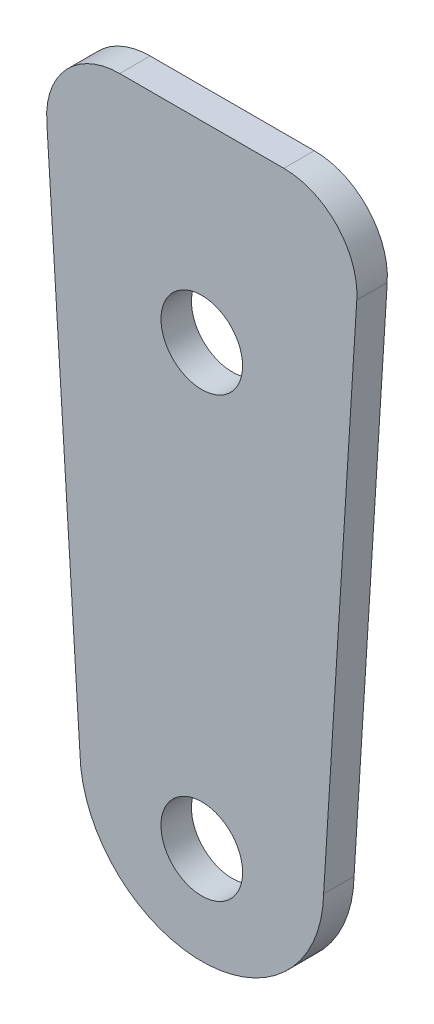
from build123d import *

# Parameters (mm, degrees)
BOSS_EXTRUDE1_DEPTH      = 76.2
BOSS_EXTRUDE1_DEPTH_BACK = 76.2
CUT_EXTRUDE1_DEPTH       = 136.619651209
CUT_EXTRUDE1_DEPTH_BACK  = 136.619651209
FILLET1_R                = 3.81
SHELL1_START             = -44.45
SHELL1_DEPTH             = 88.773
SHELL1_START_2           = -73.025
SHELL1_2_DEPTH           = 130.048
CUT_EXTRUDE2_DEPTH       = 136.355460931
CUT_EXTRUDE2_DEPTH_BACK  = 136.355460931
SKETCH8_W                = 51.042359072
SKETCH8_H                = 158.808122299
CUT_EXTRUDE3_DEPTH       = 112.770943321
CUT_EXTRUDE3_DEPTH_BACK  = 112.770943321
SKETCH9_R                = 2.127


# Read off the part's stored shape, not the designer's step: Shell1
with BuildPart() as part:
    # Sketch1 → Boss-Extrude1 (new, two sides: drawn at the far end of the back side and taken through both)
    with BuildSketch(Plane.XY.offset(-BOSS_EXTRUDE1_DEPTH_BACK)):
        with BuildLine():
            Line((-6.335258536, -105.245804705), (-12.685258536, -3.645804705))
            ThreePointArc((-12.685258536, -3.645804705), (0.014741464, 8.866413132), (12.714741464, -3.645804705))
            Line((12.714741464, -3.645804705), (6.364741464, -105.245804705))
            ThreePointArc((6.364741464, -105.245804705), (0.014741464, -111.465623147), (-6.335258536, -105.245804705))
        make_face()
    extrude(amount=BOSS_EXTRUDE1_DEPTH + BOSS_EXTRUDE1_DEPTH_BACK)

    # Sketch4 → Cut-Extrude1 (cut, two sides: drawn at the far end of the back side and taken through both)
    with BuildSketch(Plane(origin=(0, 0, 0), x_dir=(0, 0, -1), z_dir=(1, 0, 0)).offset(-CUT_EXTRUDE1_DEPTH_BACK)):
        Polygon((-47.498, -73.524605007), (-47.498, -51.299605007), (47.625, -51.299605007), (47.625, -73.524605007), (76.2, -73.524605007), (76.2, 8.866413132), (-76.2, 8.866413132), (-76.2, -28.682279346), (-76.2, -111.465623147), (-60.198, -111.465623147), (-60.198, -73.524605007), align=None)
    extrude(amount=CUT_EXTRUDE1_DEPTH + CUT_EXTRUDE1_DEPTH_BACK, mode=Mode.SUBTRACT)

    # Fillet1
    fillet1_edges = [part.edges().sort_by_distance(p)[0] for p in [
        (8.347316445, -73.524605007, 53.848),
        (9.736378945, -51.299605007, -0.0635),
        (-9.706896017, -51.299605007, -0.0635),
        (-8.317833517, -73.524605007, 53.848),
        (-8.317833517, -73.524605007, -61.9125),
        (8.347316445, -73.524605007, -61.9125),
    ]]
    fillet(fillet1_edges, radius=FILLET1_R)

    # Shell1 outline → Shell1 (cut)
    with BuildSketch(Plane.XY.offset(SHELL1_START)):
        with BuildLine():
            ThreePointArc((-3.161602106, -105.125185529), (0.014741465, -108.290623147), (3.191085035, -105.125185529))
            Line((3.191085035, -105.125185529), (6.314583179, -55.149215219))
            ThreePointArc((6.314583179, -55.149215219), (6.143625088, -54.674822007), (5.680819792, -54.474605007))
            Line((5.680819792, -54.474605007), (-5.651336863, -54.474605007))
            ThreePointArc((-5.651336863, -54.474605007), (-6.114142159, -54.674822006), (-6.285100251, -55.149215219))
            Line((-6.285100251, -55.149215219), (-3.161602106, -105.125185529))
        make_face()
    extrude(amount=SHELL1_DEPTH, mode=Mode.SUBTRACT)

    # Shell1 2 outline → Shell1 2 (cut)
    with BuildSketch(Plane.XY.offset(SHELL1_START_2)):
        with BuildLine():
            Line((-4.896037751, -77.374215219), (-3.161602106, -105.125185529))
            ThreePointArc((-3.161602106, -105.125185529), (0.014741465, -108.290623147), (3.191085035, -105.125185529))
            Line((3.191085035, -105.125185529), (4.925520679, -77.374215219))
            ThreePointArc((4.925520679, -77.374215219), (4.754562588, -76.899822007), (4.291757292, -76.699605007))
            Line((4.291757292, -76.699605007), (-4.262274363, -76.699605007))
            ThreePointArc((-4.262274363, -76.699605007), (-4.725079659, -76.899822006), (-4.896037751, -77.374215219))
        make_face()
    extrude(amount=SHELL1_2_DEPTH, mode=Mode.SUBTRACT)

    # Sketch8 → Cut-Extrude2 (cut, two sides: drawn at the far end of the back side and taken through both)
    with BuildSketch(Plane(origin=(0, 0, 0), x_dir=(1, 0, 0), z_dir=(0, 1, 0)).offset(-CUT_EXTRUDE2_DEPTH_BACK)):
        with Locations((-7.309443233, 20.79356115)):
            Rectangle(SKETCH8_W, SKETCH8_H)
    extrude(amount=CUT_EXTRUDE2_DEPTH + CUT_EXTRUDE2_DEPTH_BACK, mode=Mode.SUBTRACT)

    # Sketch9 → Cut-Extrude3 (cut, two sides: drawn at the far end of the back side and taken through both)
    with BuildSketch(Plane.XY.offset(60.198).offset(-CUT_EXTRUDE3_DEPTH_BACK)):
        with Locations((0.014741464, -106.385623147)):
            Circle(SKETCH9_R)
        with Locations((0.014741464, -83.525623147)):
            Circle(SKETCH9_R)
    extrude(amount=CUT_EXTRUDE3_DEPTH + CUT_EXTRUDE3_DEPTH_BACK, mode=Mode.SUBTRACT)


solid = part.part
